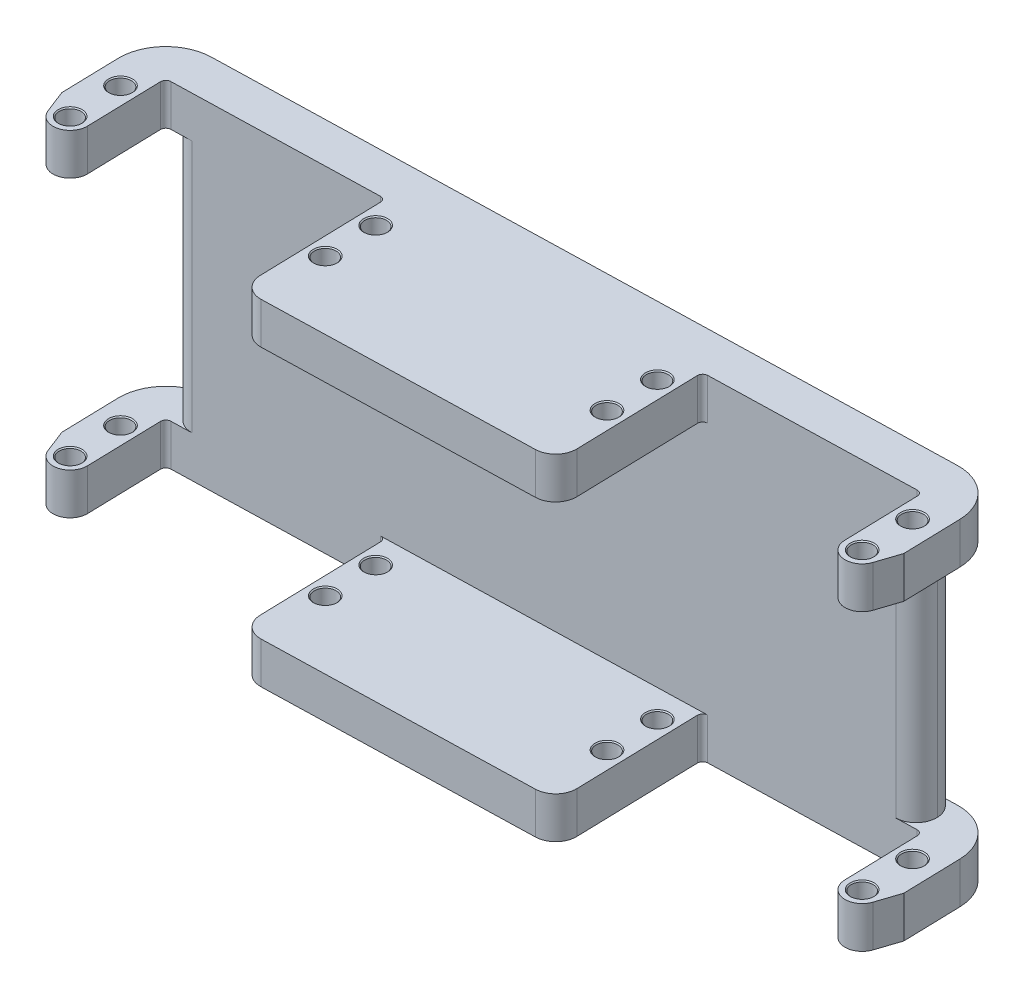
from build123d import *

# Parameters (mm, degrees)
SKETCH1_R               = 2.1
BOSS_EXTRUDE1_DEPTH     = 8
CUT_EXTRUDE1_DEPTH      = 83.763121875
CUT_EXTRUDE1_DEPTH_BACK = 83.763121875
FILLET1_R               = 4
BOSS_EXTRUDE3_DEPTH     = 32.4
FILLET2_R               = 4
CHAMFER1_SIZE           = 0.2
CUT_EXTRUDE2_DEPTH      = 105.575666009
CUT_EXTRUDE2_DEPTH_BACK = 105.575666009


# Some blends are built 0.0001 mm under size
with BuildPart() as part:
    # Sketch1 → Boss-Extrude1 (new body)
    with BuildSketch(Plane(origin=(0, 0, 0), x_dir=(1, 0, 0), z_dir=(0, 1, 0))):
        with BuildLine():
            Line((-70.864845863, 15.780379515), (-35.466300888, 16.725210272))
            Line((-35.466300888, 16.725210272), (69.48516879, 19.526494281))
            ThreePointArc((69.48516879, 19.526494281), (75.917198196, 17.061195279), (78.722100163, 10.769834027))
            Line((78.722100163, 10.769834027), (79.226384838, -8.123437182))
            ThreePointArc((79.226384838, -8.123437182), (76.761085835, -14.555466588), (70.469724584, -17.360368555))
            Line((70.469724584, -17.360368555), (31.083751799, -18.411628671))
            Line((31.083751799, -18.411628671), (-30.494317325, -20.055223167))
            Line((-30.494317325, -20.055223167), (-69.899061685, -21.106984319))
            ThreePointArc((-69.899061685, -21.106984319), (-76.350893978, -18.617392759), (-79.12407525, -12.282278576))
            Line((-79.12407525, -12.282278576), (-79.621534627, 6.544520181))
            ThreePointArc((-79.621534627, 6.544520181), (-77.155838183, 12.975866673), (-70.864845863, 15.780379515))
        make_face()
        with Locations(Location((74.409324442, -3.800425599, 0), (0, 0, 270))):
            Circle(SKETCH1_R, mode=Mode.SUBTRACT)
        with Locations(Location((74.142507154, 6.196014194, 0), (0, 0, 270))):
            Circle(SKETCH1_R, mode=Mode.SUBTRACT)
        with Locations(Location((26.426413436, -5.081148583, 0), (0, 0, 270))):
            Circle(SKETCH1_R, mode=Mode.SUBTRACT)
        with Locations(Location((26.159596147, 4.91529121, 0), (0, 0, 270))):
            Circle(SKETCH1_R, mode=Mode.SUBTRACT)
        with Locations(Location((-26.554717467, -6.495280211, 0), (0, 0, 270))):
            Circle(SKETCH1_R, mode=Mode.SUBTRACT)
        with Locations(Location((-26.821534756, 3.501159582, 0), (0, 0, 270))):
            Circle(SKETCH1_R, mode=Mode.SUBTRACT)
        with Locations(Location((-74.537628474, -7.776003195, 0), (0, 0, 270))):
            Circle(SKETCH1_R, mode=Mode.SUBTRACT)
        with Locations(Location((-74.804445762, 2.220436598, 0), (0, 0, 270))):
            Circle(SKETCH1_R, mode=Mode.SUBTRACT)
        with BuildLine():
            ThreePointArc((29.843972261, -9.441514586), (30.155628035, -10.140554725), (30.870297969, -10.414476836))
            Line((30.870297969, -10.414476836), (70.256270753, -9.363216721))
            ThreePointArc((70.256270753, -9.363216721), (70.955310892, -9.051560946), (71.229233003, -8.336891012))
            Line((71.229233003, -8.336891012), (70.724948329, 10.556380196))
            ThreePointArc((70.724948329, 10.556380196), (70.413292554, 11.255420335), (69.69862262, 11.529342447))
            Line((69.69862262, 11.529342447), (30.312649836, 10.478082331))
            ThreePointArc((30.312649836, 10.478082331), (29.613609697, 10.166426557), (29.339687586, 9.451756623))
            Line((29.339687586, 9.451756623), (29.843972261, -9.441514586))
        make_face(mode=Mode.SUBTRACT)
        with BuildLine():
            ThreePointArc((-30.707771156, -12.058071332), (-30.008731017, -11.746415558), (-29.734808906, -11.031745624))
            Line((-29.734808906, -11.031745624), (-30.239093581, 7.861525585))
            ThreePointArc((-30.239093581, 7.861525585), (-30.550749355, 8.560565724), (-31.265419289, 8.834487835))
            Line((-31.265419289, 8.834487835), (-70.651392073, 7.783227719))
            ThreePointArc((-70.651392073, 7.783227719), (-71.350432212, 7.471571945), (-71.624354323, 6.756902011))
            Line((-71.624354323, 6.756902011), (-71.125477199, -12.123547233))
            ThreePointArc((-71.125477199, -12.123547233), (-70.827127775, -12.830450686), (-70.112515516, -13.109832485))
            Line((-70.112515516, -13.109832485), (-30.707771156, -12.058071332))
        make_face(mode=Mode.SUBTRACT)
    extrude(amount=BOSS_EXTRUDE1_DEPTH)

    # Sketch3 → Cut-Extrude1 (cut, two sides: drawn at the far end of the back side and taken through both)
    with BuildSketch(Plane(origin=(0, 8, 0), x_dir=(1, 0, 0), z_dir=(0, 1, 0)).offset(-CUT_EXTRUDE1_DEPTH_BACK)):
        with BuildLine():
            Line((-29.494673346, -20.028541438), (-30.239093581, 7.861525585))
            Line((-30.239093581, 7.861525585), (-71.624354323, 6.756902011))
            Line((-71.624354323, 6.756902011), (-70.888852186, -21.078831628))
            ThreePointArc((-70.888852186, -21.078831628), (-70.39434498, -21.106550818), (-69.899061685, -21.106984319))
            Line((-69.899061685, -21.106984319), (-29.494673346, -20.028541438))
        make_face()
        with BuildLine():
            Line((30.08410782, -18.4383104), (29.339687586, 9.451756623))
            Line((29.339687586, 9.451756623), (70.724948329, 10.556380196))
            Line((70.724948329, 10.556380196), (71.467881641, -17.277978576))
            ThreePointArc((71.467881641, -17.277978576), (70.969950082, -17.333069132), (70.469724584, -17.360368555))
            Line((70.469724584, -17.360368555), (30.08410782, -18.4383104))
        make_face()
    extrude(amount=CUT_EXTRUDE1_DEPTH + CUT_EXTRUDE1_DEPTH_BACK, mode=Mode.SUBTRACT)

    # Fillet1
    # the kernel refuses this fillet: 4 mm, written as the material it takes off along each edge
    with BuildSketch(Plane(origin=(71.467881641, -29.999971781, 17.277978576), x_dir=(-0.026681728828959392, 0, -0.9996439792979788), z_dir=(0, 1, 0))) as fillet1_piece_1:
        with BuildLine():
            CenterArc((8.944263392, -4), FILLET1_R, 90, 179.99990239)
            ThreePointArc((8.944256578, -8), (2.944266196, -5.708198822), (0, 0))
            Line((0, 0), (8.944263392, 0))
        make_face()
    extrude(amount=67.999943561, mode=Mode.SUBTRACT)
    with BuildSketch(Plane(origin=(30.08410782, 18, 18.4383104), x_dir=(-0.999643979297979, 0, 0.026681728828958834), z_dir=(0, -1, 0)), Plane(origin=(-29.494673346, 18, 20.028541438), x_dir=(-0.0266817288289589, 0, -0.9996439792979788), z_dir=(0, -1, 0))) as fillet1_piece_2:
        with BuildLine():
            CenterArc((FILLET1_R, FILLET1_R), FILLET1_R, 180, 90)
            Line((0, FILLET1_R), (0, 0))
            Line((0, 0), (FILLET1_R, 0))
        make_face()
    extrude(amount=28, mode=Mode.SUBTRACT)
    with BuildSketch(Plane(origin=(-70.888852186, 37.781204383, 21.078831628), x_dir=(-0.6908787333100368, 0, -0.7229706604419843), z_dir=(0, -1, 0))) as fillet1_piece_3:
        with BuildLine():
            CenterArc((9.261327067, 2.995226007), FILLET1_R, 132.186137322, 179.326763792)
            Line((6.575161738, 5.959094395), (0, 0))
            ThreePointArc((0, 0), (5.956240877, -2.257384664), (11.912481753, 0))
        make_face()
    extrude(amount=67.562408766, mode=Mode.SUBTRACT)

    # Sketch4 → Boss-Extrude3 (add)
    with BuildSketch(Plane(origin=(0, 0, 0), x_dir=(1, 0, 0), z_dir=(0, 1, 0))):
        Polygon((69.485168831, 19.526494242), (69.69862262, 11.529342447), (-70.651392073, 7.783227719), (-70.864845863, 15.780379515), align=None)
    extrude(amount=BOSS_EXTRUDE3_DEPTH)

    # Fillet2
    fillet2_edges = [part.edges().sort_by_distance(p)[0] for p in [
        (-70.651392073, 20.2, -7.783227719),
        (-70.864845863, 20.2, -15.780379515),
        (69.69862262, 20.2, -11.529342447),
        (69.485168831, 20.2, -19.526494242),
    ]]
    fillet(fillet2_edges, radius=FILLET2_R - 0.0001)  # a hair under: the kernel refuses the full size

    # Chamfer1
    chamfer1_edges = [part.edges().sort_by_distance(p)[0] for p in [
        (74.409324442, 8, 1.700425599),
        (74.142507154, 8, -8.296014194),
        (26.426413436, 8, 2.981148583),
        (26.159596147, 8, -7.01529121),
        (-26.554717467, 8, 4.395280211),
        (-26.821534756, 8, -5.601159582),
        (-74.537628474, 8, 5.676003195),
        (-74.804445762, 8, -4.320436598),
        (-74.804445762, 0, -4.320436598),
        (-74.537628474, 0, 5.676003195),
        (-26.821534756, 0, -5.601159582),
        (-26.554717467, 0, 4.395280211),
        (26.159596147, 0, -7.01529121),
        (26.426413436, 0, 2.981148583),
        (74.142507154, 0, -8.296014194),
        (74.409324442, 0, 1.700425599),
    ]]
    chamfer(chamfer1_edges, length=CHAMFER1_SIZE)

    # Mirror2: part across plane


with BuildPart() as part_1:
    add(part.part)
    add(part.part.mirror(Plane.ZX.offset(32.4)))

    # Sketch5 → Cut-Extrude2 (cut, two sides: drawn at the far end of the back side and taken through both)
    with BuildSketch(Plane(origin=(0, 64.8, 0), x_dir=(1, 0, 0), z_dir=(0, 1, 0)).offset(-CUT_EXTRUDE2_DEPTH_BACK)):
        with BuildLine():
            ThreePointArc((-71.242652588, -7.688940219), (-73.880844595, -11.006031211), (-77.604955487, -8.982631157))
            Line((-77.604955487, -8.982631157), (-79.326924279, -4.605274126))
            Line((-79.326924279, -4.605274126), (-79.12407525, -12.282278576))
            ThreePointArc((-79.12407525, -12.282278576), (-79.121975901, -12.374380882), (-79.118932491, -12.466456827))
            ThreePointArc((-79.118932491, -12.466456827), (-74.992700441, -16.31174058), (-71.123241189, -12.208171017))
            Line((-71.123241189, -12.208171017), (-71.124100475, -12.175650546))
            ThreePointArc((-71.124100475, -12.175650546), (-71.125132958, -12.149607982), (-71.125477199, -12.123547233))
            Line((-71.125477199, -12.123547233), (-71.242652588, -7.688940219))
        make_face()
        with BuildLine():
            Line((79.226384838, -8.123437182), (79.019632787, -0.377370792))
            Line((79.019632787, -0.377370792), (77.541914094, -4.838154884))
            ThreePointArc((77.541914094, -4.838154884), (73.927264918, -7.065026435), (71.11049931, -3.888475305))
            Line((71.11049931, -3.888475305), (71.229233003, -8.336891012))
            ThreePointArc((71.229233003, -8.336891012), (75.334535836, -12.228740014), (79.226384838, -8.123437182))
        make_face()
    extrude(amount=CUT_EXTRUDE2_DEPTH + CUT_EXTRUDE2_DEPTH_BACK, mode=Mode.SUBTRACT)


with BuildPart() as cut_extrude2_kept_piece:
    # of the separate pieces the step leaves, the one the design keeps (cut_extrude2_pieces_kept)
    add(part_1.part.solids().sort_by_distance((-70.758116301, 8, -11.781703692))[0])


solid = cut_extrude2_kept_piece.part
